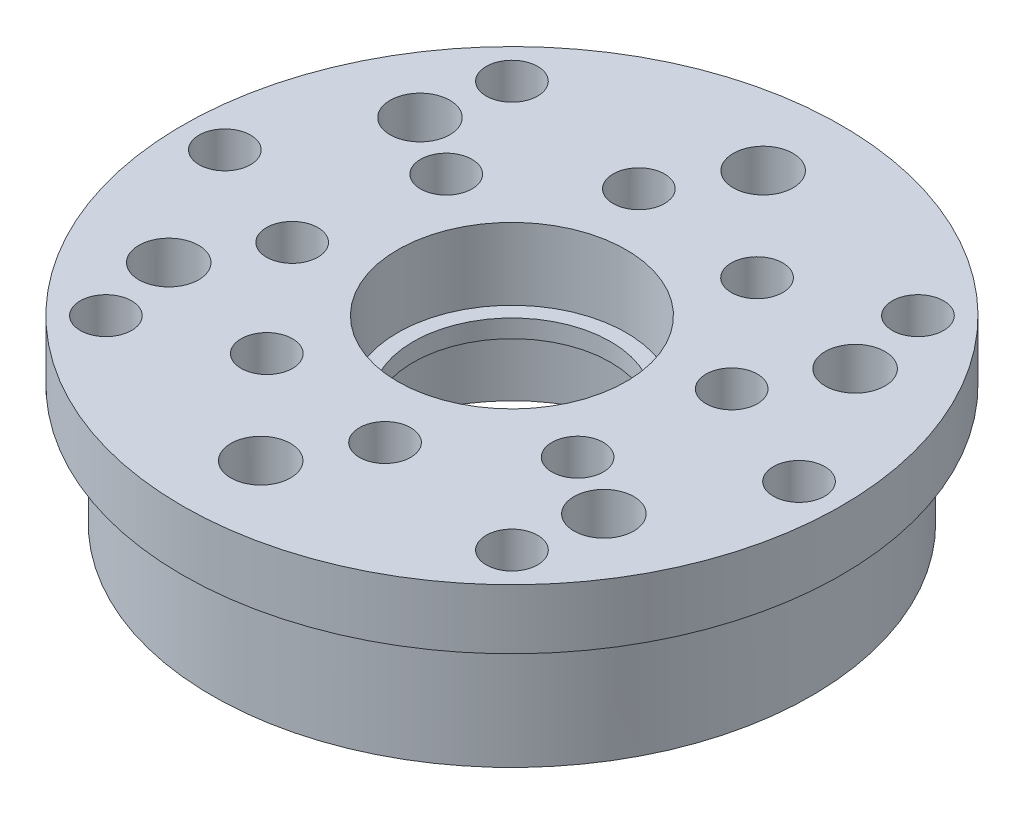
from build123d import *

# Parameters (mm, degrees)
SKETCH1_R           = 25.05
SKETCH1_R_2         = 2.5
SKETCH1_R_3         = 8.25
BOSS_EXTRUDE1_DEPTH = 10
SKETCH2_R           = 15.55
SKETCH2_R_2         = 9.55
BOSS_EXTRUDE2_DEPTH = 8.5
SKETCH4_R           = 9.55
SKETCH4_R_2         = 8.25
BOSS_EXTRUDE3_DEPTH = 2.5
SKETCH3_R           = 12.5
CUT_EXTRUDE1_DEPTH  = 11
CHAMFER1_SIZE       = 3
SKETCH5_R           = 25.05
SKETCH5_R_2         = 2.5
SKETCH5_R_3         = 15.55
BOSS_EXTRUDE4_DEPTH = 8.5
BOSS_EXTRUDE5_START = -5
SKETCH6_R           = 27.55
SKETCH6_R_2         = 25.05
BOSS_EXTRUDE5_DEPTH = 5
SKETCH11_R          = 2.15
CUT_EXTRUDE3_DEPTH  = 4.8
SKETCH12_R          = 25.05
SKETCH12_R_2        = 2.5
SKETCH12_R_3        = 12.5
CUT_EXTRUDE4_DEPTH  = 3.5


with BuildPart() as part:
    # Sketch1 → Boss-Extrude1 (new body)
    with BuildSketch(Plane(origin=(0, 0, 0), x_dir=(1, 0, 0), z_dir=(0, 1, 0))):
        Circle(SKETCH1_R)
        with Locations((0, 21)):
            Circle(SKETCH1_R_2, mode=Mode.SUBTRACT)
        with Locations((18.186533479, 10.5)):
            Circle(SKETCH1_R_2, mode=Mode.SUBTRACT)
        with Locations((18.186533479, -10.5)):
            Circle(SKETCH1_R_2, mode=Mode.SUBTRACT)
        with Locations((0, -21)):
            Circle(SKETCH1_R_2, mode=Mode.SUBTRACT)
        with Locations((-18.186533479, -10.5)):
            Circle(SKETCH1_R_2, mode=Mode.SUBTRACT)
        with Locations((-18.186533479, 10.5)):
            Circle(SKETCH1_R_2, mode=Mode.SUBTRACT)
        Circle(SKETCH1_R_3, mode=Mode.SUBTRACT)
    extrude(amount=BOSS_EXTRUDE1_DEPTH)

    # Sketch2 → Boss-Extrude2 (add)
    with BuildSketch(Plane(origin=(0, 10, 0), x_dir=(1, 0, 0), z_dir=(0, 1, 0))):
        Circle(SKETCH2_R)
        Circle(SKETCH2_R_2, mode=Mode.SUBTRACT)
    extrude(amount=BOSS_EXTRUDE2_DEPTH)

    # Sketch4 → Boss-Extrude3 (add)
    with BuildSketch(Plane(origin=(0, 10, 0), x_dir=(1, 0, 0), z_dir=(0, 1, 0))):
        Circle(SKETCH4_R)
        Circle(SKETCH4_R_2, mode=Mode.SUBTRACT)
    extrude(amount=BOSS_EXTRUDE3_DEPTH)

    # Sketch3 → Cut-Extrude1 (cut)
    with BuildSketch(Plane.XZ):
        Circle(SKETCH3_R)
    extrude(amount=-CUT_EXTRUDE1_DEPTH, mode=Mode.SUBTRACT)

    # Chamfer1
    chamfer1_edges = [part.edges().sort_by_distance(p)[0] for p in [
        (-12.5, 11, 0),
    ]]
    chamfer(chamfer1_edges, length=CHAMFER1_SIZE)


with BuildPart() as boss_extrude4_tool:
    # Sketch5 → Boss-Extrude4 (new body)
    with BuildSketch(Plane(origin=(0, 10, 0), x_dir=(1, 0, 0), z_dir=(0, 1, 0))):
        Circle(SKETCH5_R)
        with Locations((0, 21)):
            Circle(SKETCH5_R_2, mode=Mode.SUBTRACT)
        with Locations((18.187152059, 10.499642863)):
            Circle(SKETCH5_R_2, mode=Mode.SUBTRACT)
        with Locations((18.187152059, -10.50107141)):
            Circle(SKETCH5_R_2, mode=Mode.SUBTRACT)
        with Locations((0, -21.001428547)):
            Circle(SKETCH5_R_2, mode=Mode.SUBTRACT)
        with Locations((-18.187152059, -10.50107141)):
            Circle(SKETCH5_R_2, mode=Mode.SUBTRACT)
        with Locations((-18.187152059, 10.499642863)):
            Circle(SKETCH5_R_2, mode=Mode.SUBTRACT)
        Circle(SKETCH5_R_3, mode=Mode.SUBTRACT)
    extrude(amount=BOSS_EXTRUDE4_DEPTH)


with BuildPart() as part_1:
    add(part.part)


with BuildPart() as part_2:
    # Boss-Extrude4: joined with boss_extrude4_tool
    add(part_1.part.fuse(boss_extrude4_tool.part, tol=0.00001))

    # Sketch6 → Boss-Extrude5 (add)
    with BuildSketch(Plane(origin=(0, 18.5, 0), x_dir=(1, 0, 0), z_dir=(0, 1, 0)).offset(BOSS_EXTRUDE5_START)):
        Circle(SKETCH6_R)
        Circle(SKETCH6_R_2, mode=Mode.SUBTRACT)
    extrude(amount=BOSS_EXTRUDE5_DEPTH)

    # Sketch11 → Cut-Extrude3 (cut)
    with BuildSketch(Plane(origin=(0, 18.5, 0), x_dir=(1, 0, 0), z_dir=(0, 1, 0))):
        with Locations((7.5, 12.990381057)):
            Circle(SKETCH11_R)
        with Locations((14.488887394, 3.882285677)):
            Circle(SKETCH11_R)
        with Locations((12.990381057, -7.5)):
            Circle(SKETCH11_R)
        with Locations((3.882285677, -14.488887394)):
            Circle(SKETCH11_R)
        with Locations((-7.5, -12.990381057)):
            Circle(SKETCH11_R)
        with Locations((-14.488887394, -3.882285677)):
            Circle(SKETCH11_R)
        with Locations((-24, 0)):
            Circle(SKETCH11_R)
        with Locations((-16.970562748, 16.970562748)):
            Circle(SKETCH11_R)
        with Locations((16.970562748, 16.970562748)):
            Circle(SKETCH11_R)
        with Locations((24, 0)):
            Circle(SKETCH11_R)
        with Locations((16.970562748, -16.970562748)):
            Circle(SKETCH11_R)
        with Locations((-12.990381057, 7.5)):
            Circle(SKETCH11_R)
        with Locations((-3.882285677, 14.488887394)):
            Circle(SKETCH11_R)
        with Locations((-16.970562748, -16.970562748)):
            Circle(SKETCH11_R)
    extrude(amount=-CUT_EXTRUDE3_DEPTH, mode=Mode.SUBTRACT)

    # Sketch12 → Cut-Extrude4 (cut)
    with BuildSketch(Plane.XZ):
        Circle(SKETCH12_R)
        with Locations((18.186533479, 10.5)):
            Circle(SKETCH12_R_2, mode=Mode.SUBTRACT)
        with Locations((18.186533479, -10.5)):
            Circle(SKETCH12_R_2, mode=Mode.SUBTRACT)
        with Locations((0, -21)):
            Circle(SKETCH12_R_2, mode=Mode.SUBTRACT)
        with Locations((-18.186533479, -10.5)):
            Circle(SKETCH12_R_2, mode=Mode.SUBTRACT)
        with Locations((-18.186533479, 10.5)):
            Circle(SKETCH12_R_2, mode=Mode.SUBTRACT)
        with Locations((0, 21)):
            Circle(SKETCH12_R_2, mode=Mode.SUBTRACT)
        Circle(SKETCH12_R_3, mode=Mode.SUBTRACT)
    extrude(amount=-CUT_EXTRUDE4_DEPTH, mode=Mode.SUBTRACT)


solid = part_2.part
